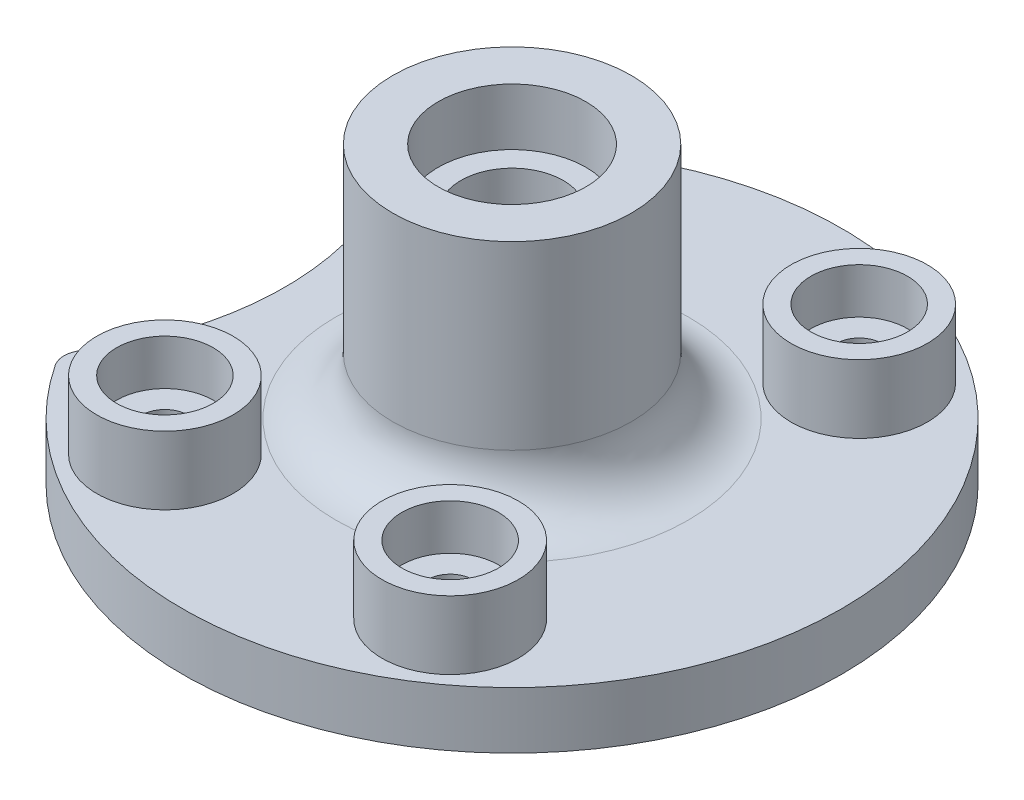
from build123d import *

# Parameters (mm, degrees)
ESQUISSE3_R             = 6.5
BOSS_EXTRU_1_DEPTH      = 5
CONG_1_R                = 5
ESQUISSE5_R             = 6
ESQUISSE5_R_2           = 4.25
BOSS_EXTRU_3_DEPTH      = 6
ESQUISSE8_R             = 4.25
BOSS_EXTRU_4_DEPTH      = 2
ESQUISSE6_R             = 2
ENL_V_MAT_EXTRU_1_DEPTH = 47.030533345
ESQUISSE7_R             = 3
ENL_V_MAT_EXTRU_2_DEPTH = 3
CONG_2_R                = 2


with BuildPart() as part:
    # Esquisse2 → Révolution1 (revolve)
    with BuildSketch(Plane(origin=(0, 0, 0), x_dir=(0, 0, -1), z_dir=(1, 0, 0))):
        Polygon((6.5, 5), (6.5, 10), (10.5, 10), (10.5, -10.9), (6.5, -10.9), (6.5, -5), (4.5, -5), (4.5, 0), (4.5, 5), align=None)
    revolve(axis=Axis((0, 0, 0), (0, 1, 0)))

    # Esquisse3 → Boss.-Extru.1 (add)
    with BuildSketch(Plane(origin=(0, -10.9, 0), x_dir=(1, 0, 0), z_dir=(0, 1, 0))):
        with BuildLine():
            ThreePointArc((-24.9, 14.865732407), (-20, 0), (-24.9, -14.865732407))
            ThreePointArc((-24.9, -14.865732407), (29, 0), (-24.9, 14.865732407))
        make_face()
        Circle(ESQUISSE3_R, mode=Mode.SUBTRACT)
    extrude(amount=-BOSS_EXTRU_1_DEPTH)

    # Congé1
    cong_1_edges = [part.edges().sort_by_distance(p)[0] for p in [
        (0, -10.9, 10.5),
    ]]
    fillet(cong_1_edges, radius=CONG_1_R)

    # Esquisse5 → Boss.-Extru.3 (add)
    # profile 1 of 2: a face of its own
    with BuildSketch(Plane(origin=(0, -10.9, 0), x_dir=(1, 0, 0), z_dir=(0, 1, 0))):
        with Locations((-12.550755593, 17.998053071)):
            Circle(ESQUISSE5_R)
        with Locations((-12.550755593, 17.998053071)):
            Circle(ESQUISSE5_R_2, mode=Mode.SUBTRACT)
    # profile 2 of 2: a face of its own
    with BuildSketch(Plane(origin=(0, -10.9, 0), x_dir=(1, 0, 0), z_dir=(0, 1, 0))):
        with Locations((-12.550755593, -17.998053071)):
            Circle(ESQUISSE5_R)
        with Locations((-12.550755593, -17.998053071)):
            Circle(ESQUISSE5_R_2, mode=Mode.SUBTRACT)
    boss_extru_3 = extrude(amount=BOSS_EXTRU_3_DEPTH)

    # Esquisse8 → Boss.-Extru.4 (add)
    with BuildSketch(Plane(origin=(0, -10.9, 0), x_dir=(1, 0, 0), z_dir=(0, 1, 0))):
        with Locations((-12.550755593, -17.998053071)):
            Circle(ESQUISSE8_R)
        with Locations((-12.550755593, 17.998053071)):
            Circle(ESQUISSE8_R)
    boss_extru_4 = extrude(amount=BOSS_EXTRU_4_DEPTH)

    # Esquisse6 → Enlèv. mat.-Extru.1 (cut, symmetric)
    with BuildSketch(Plane(origin=(0, -10.9, 0), x_dir=(1, 0, 0), z_dir=(0, 1, 0))):
        with Locations((-12.550755593, -17.998053071)):
            Circle(ESQUISSE6_R)
        with Locations((-12.550755593, 17.998053071)):
            Circle(ESQUISSE6_R)
    enl_v_mat_extru_1 = extrude(amount=ENL_V_MAT_EXTRU_1_DEPTH, both=True, mode=Mode.SUBTRACT)

    # Esquisse7 → Enlèv. mat.-Extru.2 (cut)
    with BuildSketch(Plane.XZ.offset(15.9)):
        with Locations((-12.550755593, 17.998053071)):
            Circle(ESQUISSE7_R)
        with Locations((-12.550755593, -17.998053071)):
            Circle(ESQUISSE7_R)
    enl_v_mat_extru_2 = extrude(amount=-ENL_V_MAT_EXTRU_2_DEPTH, mode=Mode.SUBTRACT)

    # Congé2
    cong_2_edges = [part.edges().sort_by_distance(p)[0] for p in [
        (-24.9, -13.4, 14.865732407),
        (-24.9, -13.4, -14.865732407),
    ]]
    fillet(cong_2_edges, radius=CONG_2_R)

    # Symétrie1: Boss.-Extru.3, Boss.-Extru.4, Enlèv. mat.-Extru.1, Enlèv. mat.-Extru.2 across plane
    add(boss_extru_3.mirror(Plane(origin=(0, 0, 0), x_dir=(0, 0, 1), z_dir=(1, 0, 0))))
    add(boss_extru_4.mirror(Plane(origin=(0, 0, 0), x_dir=(0, 0, 1), z_dir=(1, 0, 0))))
    add(enl_v_mat_extru_1.mirror(Plane(origin=(0, 0, 0), x_dir=(0, 0, 1), z_dir=(1, 0, 0))), mode=Mode.SUBTRACT)
    add(enl_v_mat_extru_2.mirror(Plane(origin=(0, 0, 0), x_dir=(0, 0, 1), z_dir=(1, 0, 0))), mode=Mode.SUBTRACT)


solid = part.part
